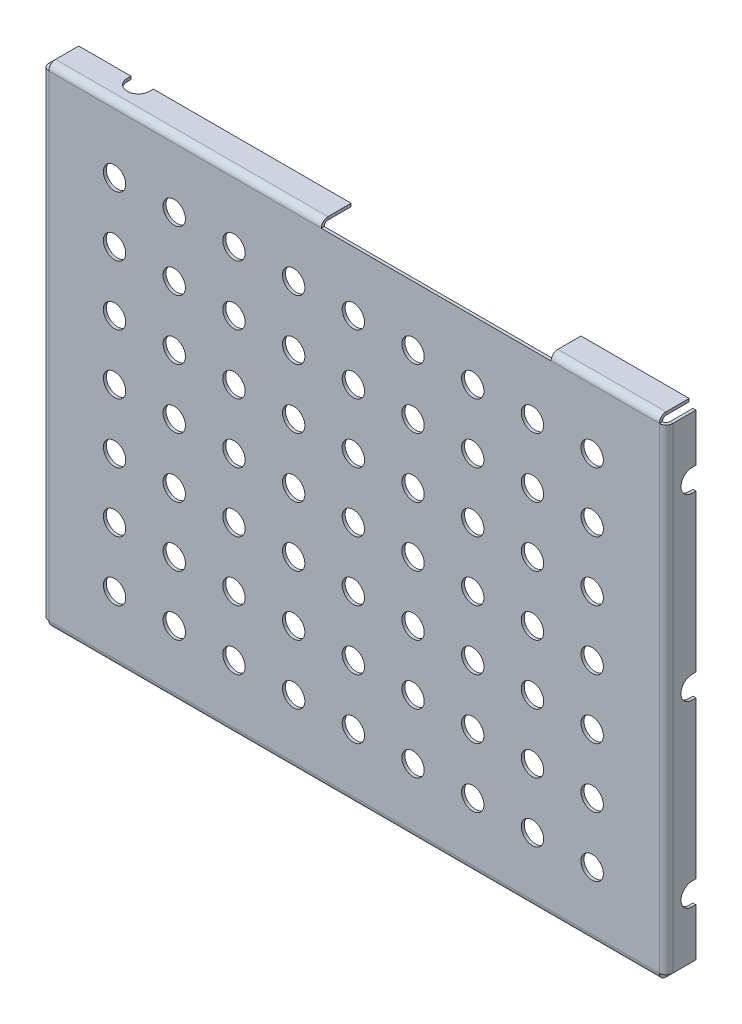
from build123d import *

# Parameters (mm, degrees)
SKETCH1_W                    = 41.8
SKETCH1_H                    = 32.8
BASE_FLANGE1_DEPTH           = 0.2
EDGE_FLANGE1_STRIP_W         = 1.3
EDGE_FLANGE1_STRIP_H         = 0.2
EDGE_FLANGE1_STRIP_CUT_DEPTH = 32.8
EDGE_FLANGE1_DEPTH           = 32.8
EDGE_FLANGE2_DEPTH           = 41.8
EDGE_FLANGE2_START           = 41.35
EDGE_FLANGE2_2_DEPTH         = 0.45
EDGE_FLANGE2_3_DEPTH         = 41.35
EDGE_FLANGE3_DEPTH           = 41.8
EDGE_FLANGE3_START           = 41.35
EDGE_FLANGE3_2_DEPTH         = 0.45
EDGE_FLANGE3_3_DEPTH         = 41.35
EDGE_FLANGE4_DEPTH           = 32.8
EDGE_FLANGE4_2_DEPTH         = 0.45
EDGE_FLANGE4_START           = 32.35
EDGE_FLANGE4_3_DEPTH         = 0.45
EDGE_FLANGE4_START_2         = 0.45
EDGE_FLANGE4_4_DEPTH         = 31.9
SKETCH20_W                   = 1.55
SKETCH20_H                   = 0.45
CUT_EXTRUDE1_DEPTH           = 0.2
SKETCH21_W                   = 0.45
SKETCH21_H                   = 1.55
CUT_EXTRUDE2_DEPTH           = 0.2
SKETCH22_W                   = 0.45
SKETCH22_H                   = 1.55
CUT_EXTRUDE3_DEPTH           = 0.2
CUT_EXTRUDE4_START           = -0.45
SKETCH23_W                   = 15.4
SKETCH23_H                   = 2
CUT_EXTRUDE4_DEPTH           = 0.45
CUT_EXTRUDE5_DEPTH           = 54.170292457
CUT_EXTRUDE6_DEPTH           = 0.2
CUT_EXTRUDE7_DEPTH           = 0.2
SKETCH29_R                   = 0.75
CUT_EXTRUDE8_DEPTH           = 0.2


# Read off the part's stored shape, not the designer's step: Edge-Flange2, Edge-Flange3, Edge-Flange4
# Sheet-metal steps are written as plain solids
with BuildPart() as part:
    # Sketch1 → Base-Flange1 (new body)
    with BuildSketch(Plane.XY):
        with Locations((20.9, 16.4)):
            Rectangle(SKETCH1_W, SKETCH1_H)
    extrude(amount=-BASE_FLANGE1_DEPTH)

    # Edge-Flange1 strip (across the edge) → Edge-Flange1 strip cut (cut)
    with BuildSketch(Plane(origin=(41.8, 32.8, -0.2), x_dir=(-1, 0, 0), z_dir=(0, -1, 0))):
        with Locations((-0.2, -0.1)):
            Rectangle(EDGE_FLANGE1_STRIP_W, EDGE_FLANGE1_STRIP_H)
    extrude(amount=EDGE_FLANGE1_STRIP_CUT_DEPTH, mode=Mode.SUBTRACT)

    # Edge-Flange1 section (across the edge) → Edge-Flange1 (add)
    with BuildSketch(Plane(origin=(41.8, 32.8, -0.2), x_dir=(-1, 0, 0), z_dir=(0, -1, 0))):
        with BuildLine():
            Line((0, 0.25), (0, 1.8))
            Line((0, 1.8), (0.2, 1.8))
            Line((0.2, 1.8), (0.2, 0.25))
            ThreePointArc((0.2, 0.25), (0.273223305, 0.073223305), (0.45, 0))
            Line((0.45, 0), (0.45, -0.2))
            ThreePointArc((0.45, -0.2), (0.131801948, -0.068198052), (0, 0.25))
        make_face()
    extrude(amount=EDGE_FLANGE1_DEPTH)

    # Edge-Flange2 outline → Edge-Flange2 (cut)
    with BuildSketch(Plane.YZ):
        with BuildLine():
            ThreePointArc((0, -0.45), (0.131801948, -0.131801948), (0.45, 0))
            Line((0.45, 0), (0, 0))
            Line((0, 0), (0, -0.45))
        make_face()
        with BuildLine():
            ThreePointArc((0.45, -0.2), (0.273223305, -0.273223305), (0.2, -0.45))
            Line((0.2, -0.45), (0.45, -0.45))
            Line((0.45, -0.45), (0.45, -0.2))
        make_face()
    extrude(amount=EDGE_FLANGE2_DEPTH, mode=Mode.SUBTRACT)

    # Edge-Flange2 2 outline → Edge-Flange2 2 (cut)
    with BuildSketch(Plane.YZ.offset(EDGE_FLANGE2_START)):
        with BuildLine():
            Line((0, -0.45), (0.2, -0.45))
            ThreePointArc((0.2, -0.45), (0.273223305, -0.273223305), (0.45, -0.2))
            Line((0.45, -0.2), (0.45, 0))
            ThreePointArc((0.45, 0), (0.131801948, -0.131801948), (0, -0.45))
        make_face()
    extrude(amount=EDGE_FLANGE2_2_DEPTH, mode=Mode.SUBTRACT)

    # Edge-Flange2 3 outline → Edge-Flange2 3 (add)
    with BuildSketch(Plane.YZ):
        with BuildLine():
            ThreePointArc((0.075834261, -0.2), (0.019375696, -0.319375696), (0, -0.45))
            Line((0, -0.45), (0, -2))
            Line((0, -2), (0.2, -2))
            Line((0.2, -2), (0.2, -0.45))
            ThreePointArc((0.2, -0.45), (0.273223305, -0.273223305), (0.45, -0.2))
            Line((0.45, -0.2), (0.075834261, -0.2))
        make_face()
    extrude(amount=EDGE_FLANGE2_3_DEPTH)

    # Edge-Flange3 outline → Edge-Flange3 (cut)
    with BuildSketch(Plane.YZ):
        with BuildLine():
            Line((32.8, -0.45), (32.8, 0))
            Line((32.8, 0), (32.35, 0))
            ThreePointArc((32.35, 0), (32.668198052, -0.131801948), (32.8, -0.45))
        make_face()
        with BuildLine():
            Line((32.35, -0.45), (32.6, -0.45))
            ThreePointArc((32.6, -0.45), (32.526776695, -0.273223305), (32.35, -0.2))
            Line((32.35, -0.2), (32.35, -0.45))
        make_face()
    extrude(amount=EDGE_FLANGE3_DEPTH, mode=Mode.SUBTRACT)

    # Edge-Flange3 2 outline → Edge-Flange3 2 (cut)
    with BuildSketch(Plane.YZ.offset(EDGE_FLANGE3_START)):
        with BuildLine():
            Line((32.6, -0.45), (32.8, -0.45))
            ThreePointArc((32.8, -0.45), (32.668198052, -0.131801948), (32.35, 0))
            Line((32.35, 0), (32.35, -0.2))
            ThreePointArc((32.35, -0.2), (32.526776695, -0.273223305), (32.6, -0.45))
        make_face()
    extrude(amount=EDGE_FLANGE3_2_DEPTH, mode=Mode.SUBTRACT)

    # Edge-Flange3 3 outline → Edge-Flange3 3 (add)
    with BuildSketch(Plane.YZ):
        with BuildLine():
            Line((32.8, -2), (32.8, -0.45))
            ThreePointArc((32.8, -0.45), (32.780624304, -0.319375696), (32.724165739, -0.2))
            Line((32.724165739, -0.2), (32.35, -0.2))
            ThreePointArc((32.35, -0.2), (32.526776695, -0.273223305), (32.6, -0.45))
            Line((32.6, -0.45), (32.6, -2))
            Line((32.6, -2), (32.8, -2))
        make_face()
    extrude(amount=EDGE_FLANGE3_3_DEPTH)

    # Edge-Flange4 outline → Edge-Flange4 (cut)
    with BuildSketch(Plane(origin=(0, 0, 0), x_dir=(1, 0, 0), z_dir=(0, 1, 0))):
        with BuildLine():
            Line((0, 0.45), (0, 0))
            Line((0, 0), (0.45, 0))
            ThreePointArc((0.45, 0), (0.131801948, 0.131801948), (0, 0.45))
        make_face()
        with BuildLine():
            Line((0.45, 0.45), (0.2, 0.45))
            ThreePointArc((0.2, 0.45), (0.273223305, 0.273223305), (0.45, 0.2))
            Line((0.45, 0.2), (0.45, 0.45))
        make_face()
    extrude(amount=EDGE_FLANGE4_DEPTH, mode=Mode.SUBTRACT)

    # Edge-Flange4 2 outline → Edge-Flange4 2 (cut)
    with BuildSketch(Plane(origin=(0, 0, 0), x_dir=(1, 0, 0), z_dir=(0, 1, 0))):
        with BuildLine():
            Line((0.2, 0.45), (0, 0.45))
            ThreePointArc((0, 0.45), (0.131801948, 0.131801948), (0.45, 0))
            Line((0.45, 0), (0.45, 0.2))
            ThreePointArc((0.45, 0.2), (0.273223305, 0.273223305), (0.2, 0.45))
        make_face()
    extrude(amount=EDGE_FLANGE4_2_DEPTH, mode=Mode.SUBTRACT)

    # Edge-Flange4 3 outline → Edge-Flange4 3 (cut)
    with BuildSketch(Plane(origin=(0, 0, 0), x_dir=(1, 0, 0), z_dir=(0, 1, 0)).offset(EDGE_FLANGE4_START)):
        with BuildLine():
            Line((0.2, 0.45), (0, 0.45))
            ThreePointArc((0, 0.45), (0.131801948, 0.131801948), (0.45, 0))
            Line((0.45, 0), (0.45, 0.2))
            ThreePointArc((0.45, 0.2), (0.273223305, 0.273223305), (0.2, 0.45))
        make_face()
    extrude(amount=EDGE_FLANGE4_3_DEPTH, mode=Mode.SUBTRACT)

    # Edge-Flange4 4 outline → Edge-Flange4 4 (add)
    with BuildSketch(Plane(origin=(0, 0, 0), x_dir=(1, 0, 0), z_dir=(0, 1, 0)).offset(EDGE_FLANGE4_START_2)):
        with BuildLine():
            Line((0, 2), (0, 0.45))
            ThreePointArc((0, 0.45), (0.019375696, 0.319375696), (0.075834261, 0.2))
            Line((0.075834261, 0.2), (0.45, 0.2))
            ThreePointArc((0.45, 0.2), (0.273223305, 0.273223305), (0.2, 0.45))
            Line((0.2, 0.45), (0.2, 2))
            Line((0.2, 2), (0, 2))
        make_face()
    extrude(amount=EDGE_FLANGE4_4_DEPTH)

    # Sketch20 → Cut-Extrude1 (cut)
    with BuildSketch(Plane(origin=(41.8, 0, 0), x_dir=(0, 0, -1), z_dir=(1, 0, 0))):
        with Locations((1.225, 0.225)):
            Rectangle(SKETCH20_W, SKETCH20_H)
        with Locations((1.225, 32.575)):
            Rectangle(SKETCH20_W, SKETCH20_H)
    extrude(amount=-CUT_EXTRUDE1_DEPTH, mode=Mode.SUBTRACT)

    # Sketch21 → Cut-Extrude2 (cut)
    with BuildSketch(Plane.XZ):
        with Locations((0.225, -1.225)):
            Rectangle(SKETCH21_W, SKETCH21_H)
    extrude(amount=-CUT_EXTRUDE2_DEPTH, mode=Mode.SUBTRACT)

    # Sketch22 → Cut-Extrude3 (cut)
    with BuildSketch(Plane(origin=(0, 32.8, 0), x_dir=(1, 0, 0), z_dir=(0, 1, 0))):
        with Locations((0.225, 1.225)):
            Rectangle(SKETCH22_W, SKETCH22_H)
    extrude(amount=-CUT_EXTRUDE3_DEPTH, mode=Mode.SUBTRACT)

    # Sketch23 → Cut-Extrude4 (cut)
    with BuildSketch(Plane(origin=(0, 32.8, 0), x_dir=(1, 0, 0), z_dir=(0, 1, 0)).offset(CUT_EXTRUDE4_START)):
        with Locations((26.4, 1)):
            Rectangle(SKETCH23_W, SKETCH23_H)
    extrude(amount=CUT_EXTRUDE4_DEPTH, mode=Mode.SUBTRACT)

    # Sketch26 → Cut-Extrude5 (cut, through all)
    with BuildSketch(Plane(origin=(41.8, 0, 0), x_dir=(0, 0, -1), z_dir=(1, 0, 0))):
        with BuildLine():
            Line((2, 3.65), (2, 5.15))
            Line((2, 5.15), (1.75, 5.15))
            ThreePointArc((1.75, 5.15), (1, 4.4), (1.75, 3.65))
            Line((1.75, 3.65), (2, 3.65))
        make_face()
        with BuildLine():
            Line((2, 17.15), (1.75, 17.15))
            ThreePointArc((1.75, 17.15), (1, 16.4), (1.75, 15.65))
            Line((1.75, 15.65), (2, 15.65))
            Line((2, 15.65), (2, 17.15))
        make_face()
        with BuildLine():
            Line((1.75, 27.65), (2, 27.65))
            Line((2, 27.65), (2, 29.15))
            Line((2, 29.15), (1.75, 29.15))
            ThreePointArc((1.75, 29.15), (1, 28.4), (1.75, 27.65))
        make_face()
    extrude(amount=-CUT_EXTRUDE5_DEPTH, mode=Mode.SUBTRACT)

    # Sketch27 → Cut-Extrude6 (cut)
    with BuildSketch(Plane(origin=(0, 32.8, 0), x_dir=(1, 0, 0), z_dir=(0, 1, 0))):
        with BuildLine():
            Line((5.45, 2), (3.95, 2))
            Line((3.95, 2), (3.95, 1.75))
            ThreePointArc((3.95, 1.75), (4.7, 1), (5.45, 1.75))
            Line((5.45, 1.75), (5.45, 2))
        make_face()
    extrude(amount=-CUT_EXTRUDE6_DEPTH, mode=Mode.SUBTRACT)

    # Sketch28 → Cut-Extrude7 (cut)
    with BuildSketch(Plane.XZ):
        with BuildLine():
            Line((20.95, -2), (20.95, -1.75))
            ThreePointArc((20.95, -1.75), (20.2, -1), (19.45, -1.75))
            Line((19.45, -1.75), (19.45, -2))
            Line((19.45, -2), (20.95, -2))
        make_face()
        with BuildLine():
            Line((11.35, -2), (11.35, -1.75))
            ThreePointArc((11.35, -1.75), (10.6, -1), (9.85, -1.75))
            Line((9.85, -1.75), (9.85, -2))
            Line((9.85, -2), (11.35, -2))
        make_face()
        with BuildLine():
            Line((32.95, -2), (32.95, -1.75))
            ThreePointArc((32.95, -1.75), (32.2, -1), (31.45, -1.75))
            Line((31.45, -1.75), (31.45, -2))
            Line((31.45, -2), (32.95, -2))
        make_face()
    extrude(amount=-CUT_EXTRUDE7_DEPTH, mode=Mode.SUBTRACT)

    # Sketch29 → Cut-Extrude8 (cut)
    with BuildSketch(Plane.XY):
        with Locations((36.85, 28.35)):
            Circle(SKETCH29_R)
        with Locations((32.85, 28.35)):
            Circle(SKETCH29_R)
        with Locations((28.85, 28.35)):
            Circle(SKETCH29_R)
        with Locations((24.85, 28.35)):
            Circle(SKETCH29_R)
        with Locations((20.85, 28.35)):
            Circle(SKETCH29_R)
        with Locations((16.85, 28.35)):
            Circle(SKETCH29_R)
        with Locations((12.85, 28.35)):
            Circle(SKETCH29_R)
        with Locations((8.85, 28.35)):
            Circle(SKETCH29_R)
        with Locations((4.85, 28.35)):
            Circle(SKETCH29_R)
        with Locations((32.85, 24.35)):
            Circle(SKETCH29_R)
        with Locations((28.85, 24.35)):
            Circle(SKETCH29_R)
        with Locations((24.85, 24.35)):
            Circle(SKETCH29_R)
        with Locations((20.85, 24.35)):
            Circle(SKETCH29_R)
        with Locations((16.85, 24.35)):
            Circle(SKETCH29_R)
        with Locations((12.85, 24.35)):
            Circle(SKETCH29_R)
        with Locations((8.85, 24.35)):
            Circle(SKETCH29_R)
        with Locations((4.85, 24.35)):
            Circle(SKETCH29_R)
        with Locations((32.85, 20.35)):
            Circle(SKETCH29_R)
        with Locations((28.85, 20.35)):
            Circle(SKETCH29_R)
        with Locations((24.85, 20.35)):
            Circle(SKETCH29_R)
        with Locations((20.85, 20.35)):
            Circle(SKETCH29_R)
        with Locations((16.85, 20.35)):
            Circle(SKETCH29_R)
        with Locations((12.85, 20.35)):
            Circle(SKETCH29_R)
        with Locations((8.85, 20.35)):
            Circle(SKETCH29_R)
        with Locations((4.85, 20.35)):
            Circle(SKETCH29_R)
        with Locations((32.85, 16.35)):
            Circle(SKETCH29_R)
        with Locations((28.85, 16.35)):
            Circle(SKETCH29_R)
        with Locations((24.85, 16.35)):
            Circle(SKETCH29_R)
        with Locations((20.85, 16.35)):
            Circle(SKETCH29_R)
        with Locations((16.85, 16.35)):
            Circle(SKETCH29_R)
        with Locations((12.85, 16.35)):
            Circle(SKETCH29_R)
        with Locations((8.85, 16.35)):
            Circle(SKETCH29_R)
        with Locations((4.85, 16.35)):
            Circle(SKETCH29_R)
        with Locations((32.85, 12.35)):
            Circle(SKETCH29_R)
        with Locations((28.85, 12.35)):
            Circle(SKETCH29_R)
        with Locations((24.85, 12.35)):
            Circle(SKETCH29_R)
        with Locations((20.85, 12.35)):
            Circle(SKETCH29_R)
        with Locations((16.85, 12.35)):
            Circle(SKETCH29_R)
        with Locations((12.85, 12.35)):
            Circle(SKETCH29_R)
        with Locations((8.85, 12.35)):
            Circle(SKETCH29_R)
        with Locations((4.85, 12.35)):
            Circle(SKETCH29_R)
        with Locations((32.85, 8.35)):
            Circle(SKETCH29_R)
        with Locations((28.85, 8.35)):
            Circle(SKETCH29_R)
        with Locations((24.85, 8.35)):
            Circle(SKETCH29_R)
        with Locations((20.85, 8.35)):
            Circle(SKETCH29_R)
        with Locations((16.85, 8.35)):
            Circle(SKETCH29_R)
        with Locations((12.85, 8.35)):
            Circle(SKETCH29_R)
        with Locations((8.85, 8.35)):
            Circle(SKETCH29_R)
        with Locations((4.85, 8.35)):
            Circle(SKETCH29_R)
        with Locations((32.85, 4.35)):
            Circle(SKETCH29_R)
        with Locations((28.85, 4.35)):
            Circle(SKETCH29_R)
        with Locations((24.85, 4.35)):
            Circle(SKETCH29_R)
        with Locations((20.85, 4.35)):
            Circle(SKETCH29_R)
        with Locations((16.85, 4.35)):
            Circle(SKETCH29_R)
        with Locations((12.85, 4.35)):
            Circle(SKETCH29_R)
        with Locations((8.85, 4.35)):
            Circle(SKETCH29_R)
        with Locations((4.85, 4.35)):
            Circle(SKETCH29_R)
        with Locations((36.85, 24.35)):
            Circle(SKETCH29_R)
        with Locations((36.85, 20.35)):
            Circle(SKETCH29_R)
        with Locations((36.85, 16.35)):
            Circle(SKETCH29_R)
        with Locations((36.85, 12.35)):
            Circle(SKETCH29_R)
        with Locations((36.85, 8.35)):
            Circle(SKETCH29_R)
        with Locations((36.85, 4.35)):
            Circle(SKETCH29_R)
    extrude(amount=-CUT_EXTRUDE8_DEPTH, mode=Mode.SUBTRACT)


solid = part.part
